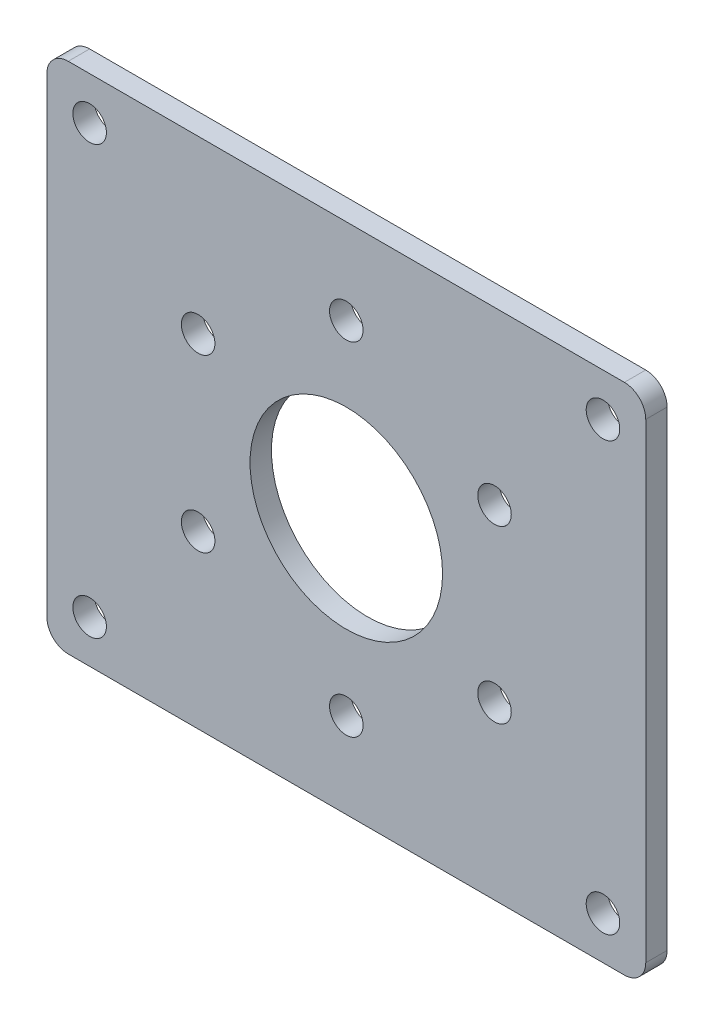
from build123d import *

# Parameters (mm, degrees)
SKETCH1_W           = 88.9
SKETCH1_H           = 76.2
SKETCH1_R           = 2.4892
SKETCH1_R_2         = 14.2875
BOSS_EXTRUDE1_DEPTH = 3.175
FILLET1_R           = 3.175


with BuildPart() as part:
    # Sketch1 → Boss-Extrude1 (new body)
    with BuildSketch(Plane.XY):
        Rectangle(SKETCH1_W, SKETCH1_H)
        with Locations((-38.1, -31.75)):
            Circle(SKETCH1_R, mode=Mode.SUBTRACT)
        with Locations((38.1, -31.75)):
            Circle(SKETCH1_R, mode=Mode.SUBTRACT)
        with Locations((-38.1, 31.75)):
            Circle(SKETCH1_R, mode=Mode.SUBTRACT)
        with Locations((38.1, 31.75)):
            Circle(SKETCH1_R, mode=Mode.SUBTRACT)
        with Locations((21.997045256, 12.7)):
            Circle(SKETCH1_R, mode=Mode.SUBTRACT)
        with Locations((-21.997045256, -12.7)):
            Circle(SKETCH1_R, mode=Mode.SUBTRACT)
        Circle(SKETCH1_R_2, mode=Mode.SUBTRACT)
        with Locations((0, -25.4)):
            Circle(SKETCH1_R, mode=Mode.SUBTRACT)
        with Locations((21.997045256, -12.7)):
            Circle(SKETCH1_R, mode=Mode.SUBTRACT)
        with Locations((-21.997045256, 12.7)):
            Circle(SKETCH1_R, mode=Mode.SUBTRACT)
        with Locations((0, 25.4)):
            Circle(SKETCH1_R, mode=Mode.SUBTRACT)
    extrude(amount=BOSS_EXTRUDE1_DEPTH)

    # Fillet1
    fillet1_edges = [part.edges().sort_by_distance(p)[0] for p in [
        (-44.45, -38.1, 1.5875),
        (44.45, 38.1, 1.5875),
        (44.45, -38.1, 1.5875),
        (-44.45, 38.1, 1.5875),
    ]]
    fillet(fillet1_edges, radius=FILLET1_R)


solid = part.part
